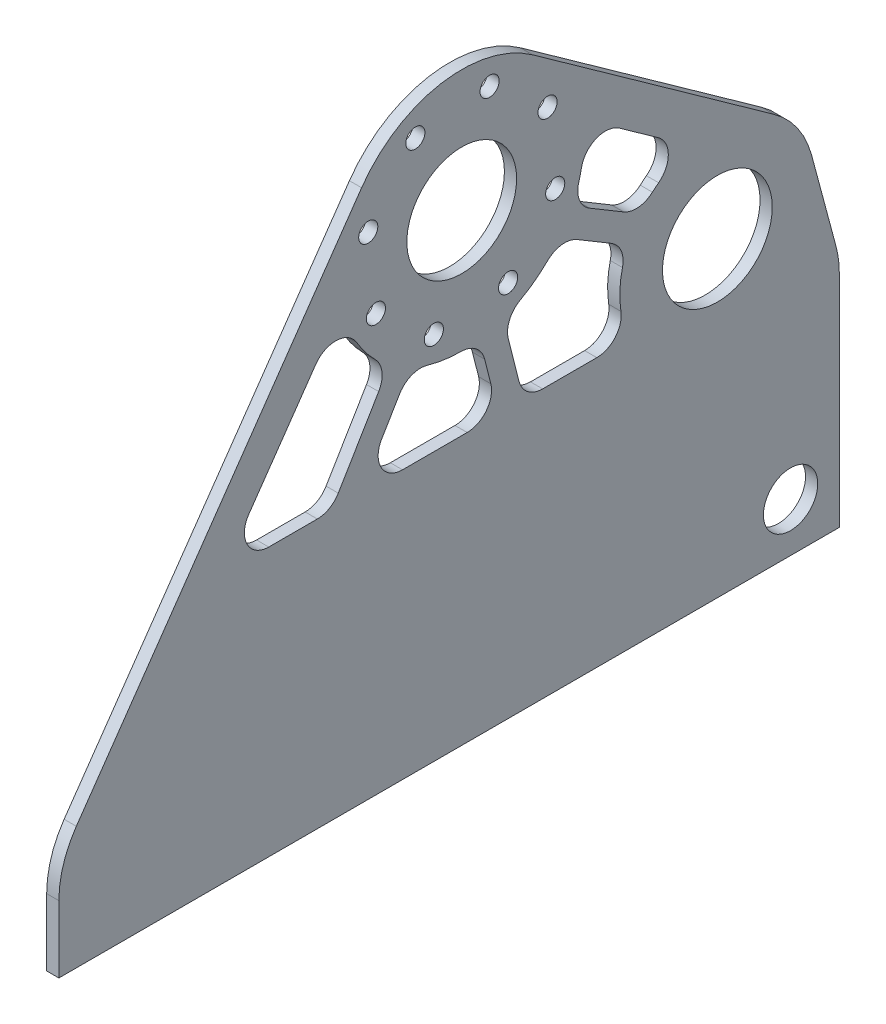
from build123d import *

# Parameters (mm, degrees)
SKETCH1_R              = 14.2875
BOSS_EXTRUDE1_DEPTH    = 3.175
F_10_CLEARANCE_HOLE1_D = 4.9784
SKETCH9_R              = 7.0739
CUT_EXTRUDE1_DEPTH     = 240.644154164
FILLET1_R              = 6.35


with BuildPart() as part:
    # Sketch1 → Boss-Extrude1 (new body)
    with BuildSketch(Plane(origin=(0, 0, 0), x_dir=(0, 0, -1), z_dir=(1, 0, 0))):
        with BuildLine():
            Line((0, -25.4), (0, 31.863977372))
            ThreePointArc((0, 31.863977372), (-0.217300521, 35.179342654), (-0.865484012, 38.437981118))
            Line((-0.865484012, 38.437981118), (-7.215484012, 62.136503746))
            ThreePointArc((-7.215484012, 62.136503746), (-10.879443925, 70.039374287), (-16.998077198, 76.239559115))
            Line((-16.998077198, 76.239559115), (-79.87164219, 121.096323894))
            ThreePointArc((-79.87164219, 121.096323894), (-103.739326535, 126.532610107), (-124.380591418, 113.373668363))
            Line((-124.380591418, 113.373668363), (-198.655236581, 6.53717796))
            ThreePointArc((-198.655236581, 6.53717796), (-202.037192589, -0.364487785), (-203.2, -7.96175673))
            Line((-203.2, -7.96175673), (-203.2, -25.4))
            Line((-203.2, -25.4), (0, -25.4))
        make_face()
        with Locations((-31.75, 55.5625)):
            Circle(SKETCH1_R, mode=Mode.SUBTRACT)
        with Locations((-98.311545692, 95.25)):
            Circle(SKETCH1_R, mode=Mode.SUBTRACT)
    extrude(amount=BOSS_EXTRUDE1_DEPTH)

    # #10 Clearance Hole1 (through all)
    with Locations(Plane(origin=(3.175, 0, 0), x_dir=(0, 0, -1), z_dir=(1, 0, 0))):
        with Locations((-91.050282965, 119.589968439), (-75.966100841, 107.326468623), (-73.971577253, 87.988737273), (-86.235077069, 72.904555149), (-105.572808419, 70.910031561), (-120.656990543, 83.173531377), (-122.651514131, 102.511262727), (-110.388014315, 117.595444851)):
            Hole(F_10_CLEARANCE_HOLE1_D / 2)

    # Sketch9 → Cut-Extrude1 (cut, through all)
    with BuildSketch(Plane(origin=(3.175, 0, 0), x_dir=(0, 0, -1), z_dir=(1, 0, 0))):
        with Locations((-12.7, -12.7)):
            Circle(SKETCH9_R)
        with BuildLine():
            Line((-160.696878852, 44.45), (-129.502765748, 89.319545428))
            ThreePointArc((-129.502765748, 89.319545428), (-125.204650592, 78.373287973), (-117.217117013, 69.742317372))
            Line((-117.217117013, 69.742317372), (-132.297729028, 44.45))
            Line((-132.297729028, 44.45), (-160.696878852, 44.45))
        make_face()
        with BuildLine():
            Line((-66.945646017, 100.173701616), (-38.671072347, 80.001377993))
            ThreePointArc((-38.671072347, 80.001377993), (-45.921454308, 76.641633825), (-51.769190034, 71.195542903))
            Line((-51.769190034, 71.195542903), (-69.551855526, 81.798504859))
            ThreePointArc((-69.551855526, 81.798504859), (-66.876157951, 90.791424263), (-66.945646017, 100.173701616))
        make_face()
        with BuildLine():
            Line((-55.021197572, 65.741466723), (-72.803863064, 76.344428679))
            ThreePointArc((-72.803863064, 76.344428679), (-79.339445973, 69.791761015), (-87.487017182, 65.402184627))
            Line((-87.487017182, 65.402184627), (-82.187487541, 44.45))
            Line((-82.187487541, 44.45), (-54.59014763, 44.45))
            ThreePointArc((-54.59014763, 44.45), (-57.144796276, 55.048377342), (-55.021197572, 65.741466723))
        make_face()
        with BuildLine():
            Line((-124.904634638, 44.45), (-111.763040833, 66.490309834))
            ThreePointArc((-111.763040833, 66.490309834), (-102.897938751, 63.833006211), (-93.643148017, 63.845086959))
            Line((-93.643148017, 63.845086959), (-88.737462043, 44.45))
            Line((-88.737462043, 44.45), (-124.904634638, 44.45))
        make_face()
    extrude(amount=-CUT_EXTRUDE1_DEPTH, mode=Mode.SUBTRACT)

    # Fillet1
    fillet1_edges = [part.edges().sort_by_distance(p)[0] for p in [
        (1.5875, 100.173701616, 66.945646017),
        (1.5875, 71.195542903, 51.769190034),
        (1.5875, 81.798504859, 69.551855526),
        (1.5875, 80.001377993, 38.671072347),
        (1.5875, 76.344428679, 72.803863064),
        (1.5875, 65.741466723, 55.021197572),
        (1.5875, 44.45, 82.187487541),
        (1.5875, 65.402184627, 87.487017182),
        (1.5875, 44.45, 54.59014763),
        (1.5875, 44.45, 124.904634638),
        (1.5875, 66.490309834, 111.763040833),
        (1.5875, 63.845086959, 93.643148017),
        (1.5875, 44.45, 88.737462043),
        (1.5875, 44.45, 160.696878852),
        (1.5875, 89.319545428, 129.502765748),
        (1.5875, 69.742317372, 117.217117013),
        (1.5875, 44.45, 132.297729028),
    ]]
    fillet(fillet1_edges, radius=FILLET1_R)


solid = part.part
